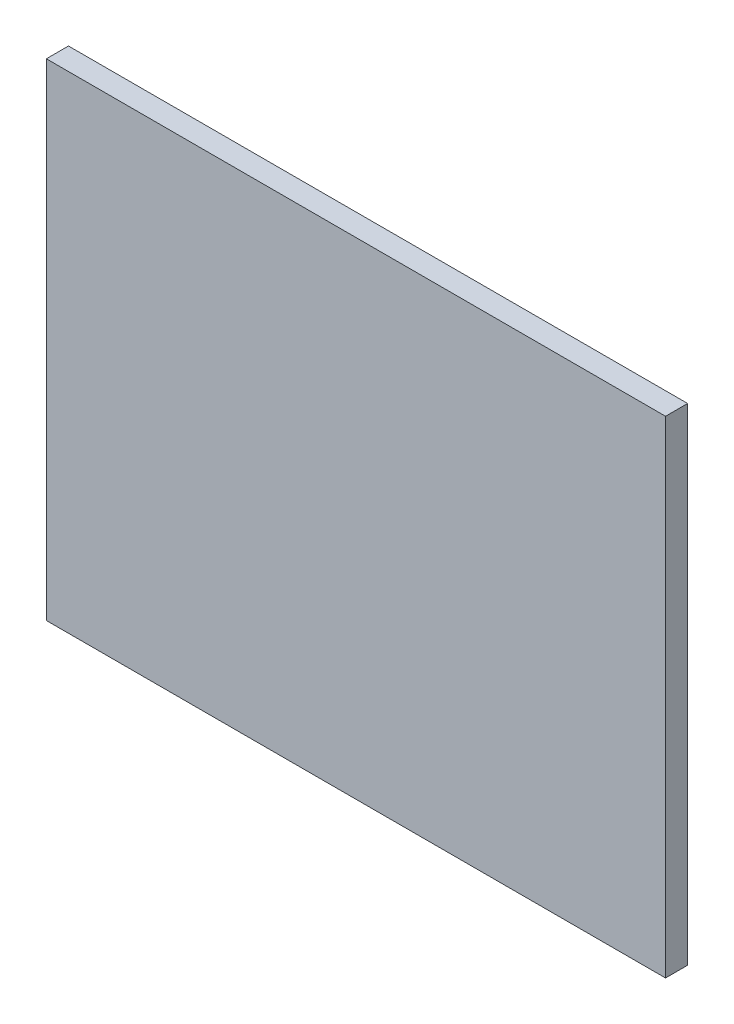
from build123d import *

# Parameters (mm, degrees)
SCHIZZO1_W                   = 56
SCHIZZO1_H                   = 44
ESTRUSIONE_ESTRUSIONE1_DEPTH = 2


with BuildPart() as part:
    # Schizzo1 → Estrusione-Estrusione1 (new body)
    with BuildSketch(Plane.XY):
        with Locations((28, 22)):
            Rectangle(SCHIZZO1_W, SCHIZZO1_H)
    extrude(amount=ESTRUSIONE_ESTRUSIONE1_DEPTH)


solid = part.part
